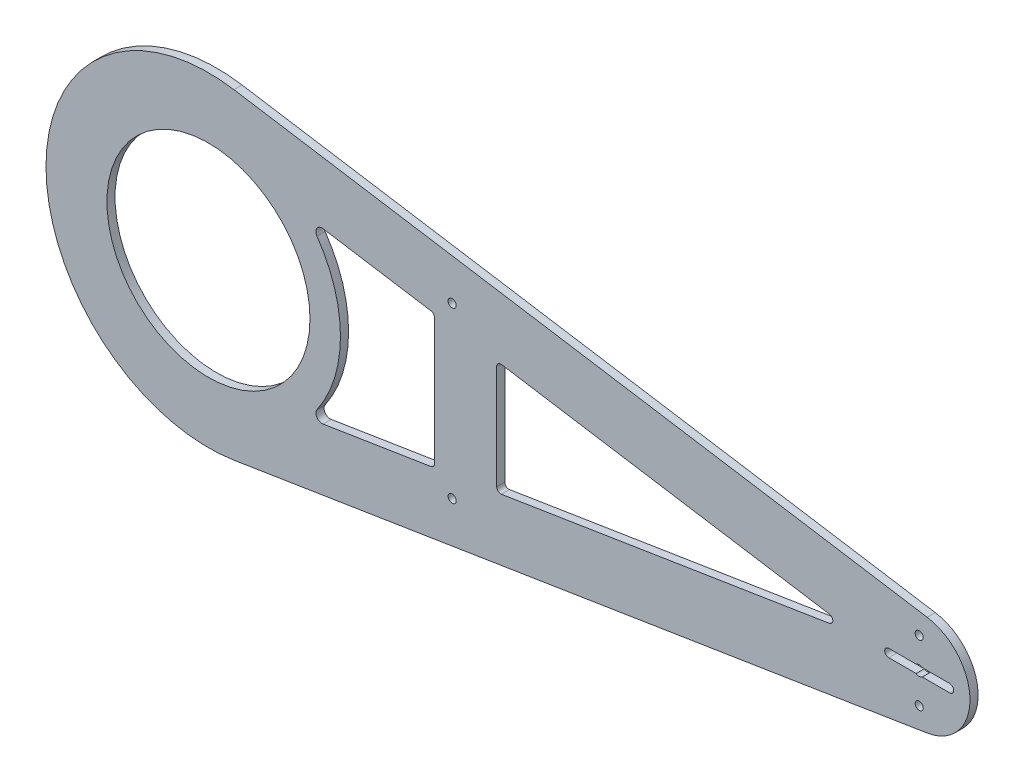
from build123d import *

# Parameters (mm, degrees)
SM_BASE_FLANGE_1_DEPTH = 4
SKETCH_6_R             = 20
SKETCH_6_R_2           = 2.5
CUT_EXTRUDE_1_DEPTH    = 10
SKETCH_7_R             = 2
CUT_EXTRUDE_2_DEPTH    = 10
CUT_EXTRUDE_3_DEPTH    = 10
SKETCH_9_R             = 2
CUT_EXTRUDE_4_DEPTH    = 80
FILLET_2_R             = 2
SKETCH_10_R            = 50
CUT_EXTRUDE_5_DEPTH    = 10


# Sheet-metal steps are written as plain solids
with BuildPart() as part:
    # Sketch 1 → 基体-法兰1 (new body)
    with BuildSketch(Plane.XY):
        with BuildLine():
            Line((12.571428571, 79.00607055), (353.928571429, 24.689397047))
            ThreePointArc((353.928571429, 24.689397047), (375, 0), (353.928571429, -24.689397047))
            Line((353.928571429, -24.689397047), (12.571428571, -79.00607055))
            ThreePointArc((12.571428571, -79.00607055), (-80, 0), (12.571428571, 79.00607055))
        make_face()
    extrude(amount=-SM_BASE_FLANGE_1_DEPTH)

    # 草图6 → 切除-拉伸1 (cut)
    with BuildSketch(Plane.XY):
        Circle(SKETCH_6_R)
        with Locations((350, 0)):
            Circle(SKETCH_6_R_2)
    extrude(amount=-CUT_EXTRUDE_1_DEPTH, mode=Mode.SUBTRACT)

    # 草图7 → 切除-拉伸2 (cut)
    with BuildSketch(Plane.XY):
        with Locations((365, 0)):
            Circle(SKETCH_7_R)
        with Locations((350, -15)):
            Circle(SKETCH_7_R)
        with Locations((335, 0)):
            Circle(SKETCH_7_R)
        with Locations((350, 15)):
            Circle(SKETCH_7_R)
        with BuildLine():
            Line((111.294862901, 32.919806827), (111.294862901, -32.919806827))
            Line((111.294862901, -32.919806827), (56.389238276, -41.656377743))
            ThreePointArc((56.389238276, -41.656377743), (53.378656764, -40.291367953), (53.450847511, -36.986577299))
            ThreePointArc((53.450847511, -36.986577299), (62.032293151, -19.416348946), (64.999939097, -0.088979461))
            ThreePointArc((64.999939097, -0.088979461), (62.058814357, 19.33141383), (53.450847511, 36.986577299))
            ThreePointArc((53.450847511, 36.986577299), (53.378656764, 40.291367953), (56.389238276, 41.656377743))
            Line((56.389238276, 41.656377743), (111.294862901, 32.919806827))
        make_face()
        Polygon((141.940088648, 28.043545246), (141.940088648, -28.043545246), (318.181818182, 0), align=None)
    extrude(amount=-CUT_EXTRUDE_2_DEPTH, mode=Mode.SUBTRACT)

    # 草图8 → 切除-拉伸3 (cut)
    with BuildSketch(Plane.XY):
        with BuildLine():
            Line((347.5, 0), (337, 0))
            ThreePointArc((337, 0), (336.414213562, -1.414213562), (335, -2))
            Line((335, -2), (348.5, -2))
            ThreePointArc((348.5, -2), (347.763932023, -1.118033989), (347.5, 0))
        make_face()
        with BuildLine():
            ThreePointArc((335, 2), (336.414213562, 1.414213562), (337, 0))
            Line((337, 0), (347.5, 0))
            ThreePointArc((347.5, 0), (347.763932023, 1.118033989), (348.5, 2))
            Line((348.5, 2), (335, 2))
        make_face()
        with BuildLine():
            ThreePointArc((351.5, 2), (352.236067977, 1.118033989), (352.5, 0))
            Line((352.5, 0), (363, 0))
            ThreePointArc((363, 0), (363.585786438, 1.414213562), (365, 2))
            Line((365, 2), (351.5, 2))
        make_face()
        with BuildLine():
            Line((363, 0), (352.5, 0))
            ThreePointArc((352.5, 0), (352.236067977, -1.118033989), (351.5, -2))
            Line((351.5, -2), (365, -2))
            ThreePointArc((365, -2), (363.585786438, -1.414213562), (363, 0))
        make_face()
    extrude(amount=-CUT_EXTRUDE_3_DEPTH, mode=Mode.SUBTRACT)

    # 草图9 → 切除-拉伸4 (cut)
    with BuildSketch(Plane.XY):
        with Locations((120, 41.660451514)):
            Circle(SKETCH_9_R)
        with Locations((120, -41.660451514)):
            Circle(SKETCH_9_R)
    extrude(amount=-CUT_EXTRUDE_4_DEPTH, mode=Mode.SUBTRACT)

    # 圆角2
    fillet_2_edges = [part.edges().sort_by_distance(p)[0] for p in [
        (141.940088648, 28.043545246, -2),
        (318.181818182, 0, -2),
        (141.940088648, -28.043545246, -2),
        (111.294862901, 32.919806827, -2),
        (111.294862901, -32.919806827, -2),
    ]]
    fillet(fillet_2_edges, radius=FILLET_2_R)

    # 草图10 → 切除-拉伸5 (cut)
    with BuildSketch(Plane.XY):
        Circle(SKETCH_10_R)
    extrude(amount=-CUT_EXTRUDE_5_DEPTH, mode=Mode.SUBTRACT)


solid = part.part
